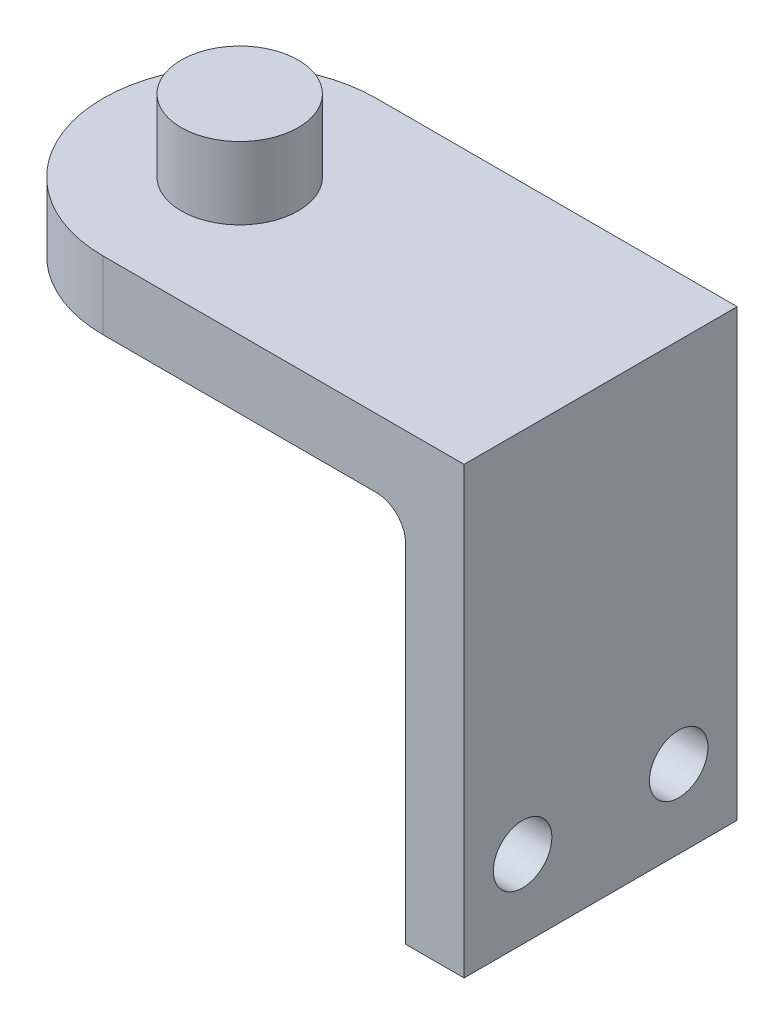
from build123d import *

# Parameters (mm, degrees)
BOSS_EXTRUDE1_DEPTH = 3.5
SKETCH2_W           = 3
SKETCH2_H           = 22.8
BOSS_EXTRUDE2_DEPTH = 7
SKETCH3_R           = 3
BOSS_EXTRUDE3_DEPTH = 3.7
SKETCH4_R           = 3.7
CUT_EXTRUDE2_DEPTH  = 1.6
CUT_EXTRUDE4_DEPTH  = 1.6
SKETCH6_W           = 1.2
SKETCH6_H           = 13.4
CUT_EXTRUDE6_DEPTH  = 2.2
SKETCH7_R           = 1.5
CUT_EXTRUDE7_DEPTH  = 3
FILLET1_R           = 1.5


with BuildPart() as part:
    # Sketch1 → Boss-Extrude1 (new body)
    with BuildSketch(Plane(origin=(0, 19.3, 0), x_dir=(1, 0, 0), z_dir=(0, 1, 0))):
        with BuildLine():
            Line((5.5, -7), (24, -7))
            Line((24, -7), (24, 7))
            Line((24, 7), (5.5, 7))
            ThreePointArc((5.5, 7), (-1.5, 0), (5.5, -7))
        make_face()
    extrude(amount=BOSS_EXTRUDE1_DEPTH)

    # Sketch2 → Boss-Extrude2 (add, symmetric)
    with BuildSketch(Plane.XY):
        with Locations((22.5, 11.4)):
            Rectangle(SKETCH2_W, SKETCH2_H)
    extrude(amount=BOSS_EXTRUDE2_DEPTH, both=True)

    # Sketch3 → Boss-Extrude3 (add)
    with BuildSketch(Plane(origin=(0, 22.8, 0), x_dir=(1, 0, 0), z_dir=(0, 1, 0))):
        with Locations(Location((5.5, 0, 0), (0, 0, 270))):
            Circle(SKETCH3_R)
    extrude(amount=BOSS_EXTRUDE3_DEPTH)

    # Sketch4 → Cut-Extrude2 (cut)
    with BuildSketch(Plane(origin=(0, 19.3, 0), x_dir=(1, 0, 0), z_dir=(0, 1, 0))):
        with Locations(Location((5.5, 0, 0), (0, 0, 270))):
            Circle(SKETCH4_R)
    extrude(amount=CUT_EXTRUDE2_DEPTH, mode=Mode.SUBTRACT)

    # Sketch5 → Cut-Extrude4 (cut)
    with BuildSketch(Plane(origin=(0, 19.3, 0), x_dir=(1, 0, 0), z_dir=(0, 1, 0))):
        with BuildLine():
            Line((5.5, -2.7), (20.7, -2.7))
            Line((20.7, -2.7), (20.7, 2.7))
            Line((20.7, 2.7), (5.5, 2.7))
            ThreePointArc((5.5, 2.7), (2.8, 0), (5.5, -2.7))
        make_face()
    extrude(amount=CUT_EXTRUDE4_DEPTH, mode=Mode.SUBTRACT)

    # Sketch6 → Cut-Extrude6 (cut)
    with BuildSketch(Plane(origin=(0, 0, 0), x_dir=(1, 0, 0), z_dir=(0, 1, 0))):
        with Locations((22.5, 0)):
            Rectangle(SKETCH6_W, SKETCH6_H)
    extrude(amount=CUT_EXTRUDE6_DEPTH, mode=Mode.SUBTRACT)

    # Sketch7 → Cut-Extrude7 (cut)
    with BuildSketch(Plane(origin=(24, 0, 0), x_dir=(0, 0, -1), z_dir=(1, 0, 0))):
        with Locations((-4, 4)):
            Circle(SKETCH7_R)
        with Locations((4, 4)):
            Circle(SKETCH7_R)
    extrude(amount=-CUT_EXTRUDE7_DEPTH, mode=Mode.SUBTRACT)

    # Fillet1
    # the kernel refuses this fillet: 1.5 mm, written as the material it adds along each edge
    with BuildSketch(Plane(origin=(21, 19.3, -7), x_dir=(-1, 0, 0), z_dir=(0, 0, 1))) as fillet1_piece_1_section:
        with BuildLine():
            CenterArc((FILLET1_R, FILLET1_R), FILLET1_R, 180, 90)
            Line((0, FILLET1_R), (0, 0))
            Line((0, 0), (FILLET1_R, 0))
        make_face()
    fillet1_piece_1 = extrude(amount=14, mode=Mode.PRIVATE)
    fillet1_piece_1 = split(fillet1_piece_1, bisect_by=Plane(origin=(20.368695353, 19.155022342, -2.7), z_dir=(0, 0, -1)), keep=Keep.TOP, mode=Mode.PRIVATE)
    fillet1_piece_1 = split(fillet1_piece_1, bisect_by=Plane(origin=(20.7, 19.155022342, -4.85), z_dir=(-1, 0, 0)), keep=Keep.TOP, mode=Mode.PRIVATE)
    add(fillet1_piece_1)
    with BuildSketch(Plane(origin=(21, 19.3, -7), x_dir=(-1, 0, 0), z_dir=(0, 0, 1))) as fillet1_piece_2_section:
        with BuildLine():
            CenterArc((FILLET1_R, FILLET1_R), FILLET1_R, 180, 90)
            Line((0, FILLET1_R), (0, 0))
            Line((0, 0), (FILLET1_R, 0))
        make_face()
    fillet1_piece_2 = extrude(amount=14, mode=Mode.PRIVATE)
    fillet1_piece_2 = split(fillet1_piece_2, bisect_by=Plane(origin=(20.890163131, 18.807126241, -2.7), z_dir=(0, 0, -1)), keep=Keep.TOP, mode=Mode.PRIVATE)
    fillet1_piece_2 = split(fillet1_piece_2, bisect_by=Plane(origin=(20.7, 18.807126241, -4.85), z_dir=(1, 0, 0)), keep=Keep.TOP, mode=Mode.PRIVATE)
    add(fillet1_piece_2)
    with BuildSketch(Plane(origin=(21, 19.3, -7), x_dir=(-1, 0, 0), z_dir=(0, 0, 1))) as fillet1_piece_3_section:
        with BuildLine():
            CenterArc((FILLET1_R, FILLET1_R), FILLET1_R, 180, 90)
            Line((0, FILLET1_R), (0, 0))
            Line((0, 0), (FILLET1_R, 0))
        make_face()
    fillet1_piece_3 = extrude(amount=14, mode=Mode.PRIVATE)
    fillet1_piece_3 = split(fillet1_piece_3, bisect_by=Plane(origin=(20.890163131, 18.807126241, 2.7), z_dir=(0, 0, -1)), keep=Keep.TOP, mode=Mode.PRIVATE)
    fillet1_piece_3 = split(fillet1_piece_3, bisect_by=Plane(origin=(20.890163131, 18.807126241, -2.7), z_dir=(0, 0, 1)), keep=Keep.TOP, mode=Mode.PRIVATE)
    fillet1_piece_3 = split(fillet1_piece_3, bisect_by=Plane(origin=(20.7, 18.807126241, 0), z_dir=(1, 0, 0)), keep=Keep.TOP, mode=Mode.PRIVATE)
    add(fillet1_piece_3)
    with BuildSketch(Plane(origin=(21, 19.3, -7), x_dir=(-1, 0, 0), z_dir=(0, 0, 1))) as fillet1_piece_4_section:
        with BuildLine():
            CenterArc((FILLET1_R, FILLET1_R), FILLET1_R, 180, 90)
            Line((0, FILLET1_R), (0, 0))
            Line((0, 0), (FILLET1_R, 0))
        make_face()
    fillet1_piece_4 = extrude(amount=14, mode=Mode.PRIVATE)
    fillet1_piece_4 = split(fillet1_piece_4, bisect_by=Plane(origin=(20.368695353, 19.155022342, 2.7), z_dir=(0, 0, 1)), keep=Keep.TOP, mode=Mode.PRIVATE)
    fillet1_piece_4 = split(fillet1_piece_4, bisect_by=Plane(origin=(20.7, 19.155022342, 4.85), z_dir=(-1, 0, 0)), keep=Keep.TOP, mode=Mode.PRIVATE)
    add(fillet1_piece_4)
    with BuildSketch(Plane(origin=(21, 19.3, -7), x_dir=(-1, 0, 0), z_dir=(0, 0, 1))) as fillet1_piece_5_section:
        with BuildLine():
            CenterArc((FILLET1_R, FILLET1_R), FILLET1_R, 180, 90)
            Line((0, FILLET1_R), (0, 0))
            Line((0, 0), (FILLET1_R, 0))
        make_face()
    fillet1_piece_5 = extrude(amount=14, mode=Mode.PRIVATE)
    fillet1_piece_5 = split(fillet1_piece_5, bisect_by=Plane(origin=(20.890163131, 18.807126241, 2.7), z_dir=(0, 0, 1)), keep=Keep.TOP, mode=Mode.PRIVATE)
    fillet1_piece_5 = split(fillet1_piece_5, bisect_by=Plane(origin=(20.7, 18.807126241, 4.85), z_dir=(1, 0, 0)), keep=Keep.TOP, mode=Mode.PRIVATE)
    add(fillet1_piece_5)


solid = part.part
